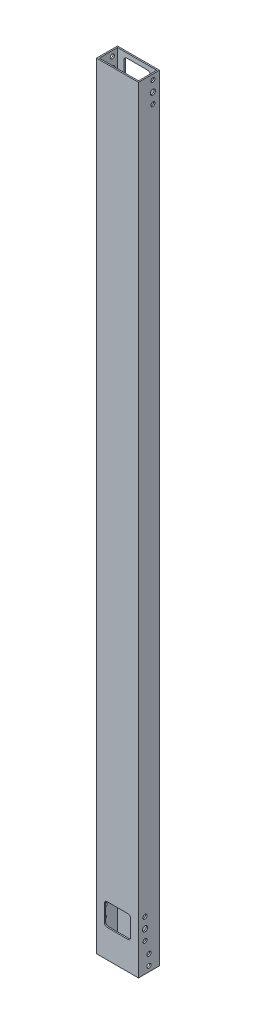
from build123d import *

# Parameters (mm, degrees)
SKETCH1_W               = 50.8
SKETCH1_H               = 939.8
BOSS_EXTRUDE1_DEPTH     = 12.7
SHELL1_T                = -1.5875
CUT_EXTRUDE1_DEPTH      = 471.757326018
CUT_EXTRUDE1_DEPTH_BACK = 471.757326018
SKETCH3_R               = 2.4892
CUT_EXTRUDE2_DEPTH      = 471.757326018
CUT_EXTRUDE2_DEPTH_BACK = 471.757326018
SKETCH4_R               = 3.175
SKETCH4_R_2             = 2.4892
SKETCH5_W               = 31.75
SKETCH5_H               = 26.9875
CUT_EXTRUDE3_DEPTH      = 471.757326018
FILLET1_R               = 3.175
CUT_EXTRUDE4_DEPTH      = 471.757326018
CUT_EXTRUDE4_DEPTH_BACK = 471.757326018
SKETCH6_R               = 3.175
SKETCH6_R_2             = 2.4892
SKETCH7_W               = 31.75
SKETCH7_H               = 26.9875
CUT_EXTRUDE5_DEPTH      = 471.757326018
FILLET2_R               = 3.175


with BuildPart() as part:
    # Sketch1 → Boss-Extrude1 (new, symmetric)
    with BuildSketch(Plane.XY):
        Rectangle(SKETCH1_W, SKETCH1_H)
    extrude(amount=BOSS_EXTRUDE1_DEPTH, both=True)

    # Shell1
    shell1_openings = [part.faces().sort_by_distance(p)[0] for p in [
        (0, -469.9, 0),
        (0, 469.9, 0),
    ]]
    offset(amount=SHELL1_T, openings=shell1_openings, kind=Kind.INTERSECTION)

    # Sketch3 → Cut-Extrude1 (cut, two sides: drawn at the far end of the back side and taken through both)
    with BuildSketch(Plane(origin=(0, 0, 0), x_dir=(0, 0, -1), z_dir=(1, 0, 0)).offset(-CUT_EXTRUDE1_DEPTH_BACK)):
        with Locations((0, -463.55)):
            Circle(SKETCH3_R)
        with Locations((0, -450.85)):
            Circle(SKETCH3_R)
    extrude(amount=CUT_EXTRUDE1_DEPTH + CUT_EXTRUDE1_DEPTH_BACK, mode=Mode.SUBTRACT)

    # Sketch4 → Cut-Extrude2 (cut, two sides: drawn at the far end of the back side and taken through both)
    with BuildSketch(Plane(origin=(0, 0, 0), x_dir=(0, 0, -1), z_dir=(1, 0, 0)).offset(-CUT_EXTRUDE2_DEPTH_BACK)):
        with Locations((-4.7625, -422.275)):
            Circle(SKETCH4_R)
        with Locations((-4.7625, -409.575)):
            Circle(SKETCH4_R_2)
        with Locations((-4.7625, -434.975)):
            Circle(SKETCH4_R_2)
    extrude(amount=CUT_EXTRUDE2_DEPTH + CUT_EXTRUDE2_DEPTH_BACK, mode=Mode.SUBTRACT)

    # Sketch5 → Cut-Extrude3 (cut, through all)
    with BuildSketch(Plane.XY):
        with Locations((0, -422.275)):
            Rectangle(SKETCH5_W, SKETCH5_H)
    extrude(amount=CUT_EXTRUDE3_DEPTH, mode=Mode.SUBTRACT)

    # Fillet1
    fillet1_edges = [part.edges().sort_by_distance(p)[0] for p in [
        (-15.875, -435.76875, 11.90625),
        (15.875, -435.76875, 11.90625),
        (-15.875, -408.78125, 11.90625),
        (15.875, -408.78125, 11.90625),
    ]]
    fillet(fillet1_edges, radius=FILLET1_R)

    # Sketch6 → Cut-Extrude4 (cut, two sides: drawn at the far end of the back side and taken through both)
    with BuildSketch(Plane(origin=(0, 0, 0), x_dir=(0, 0, -1), z_dir=(1, 0, 0)).offset(-CUT_EXTRUDE4_DEPTH_BACK)):
        with Locations((4.7625, 450.85)):
            Circle(SKETCH6_R)
        with Locations((4.7625, 463.55)):
            Circle(SKETCH6_R_2)
        with Locations((4.7625, 438.15)):
            Circle(SKETCH6_R_2)
    extrude(amount=CUT_EXTRUDE4_DEPTH + CUT_EXTRUDE4_DEPTH_BACK, mode=Mode.SUBTRACT)

    # Sketch7 → Cut-Extrude5 (cut, through all)
    with BuildSketch(Plane.XY):
        with Locations((0, 450.85)):
            Rectangle(SKETCH7_W, SKETCH7_H)
    extrude(amount=-CUT_EXTRUDE5_DEPTH, mode=Mode.SUBTRACT)

    # Fillet2
    fillet2_edges = [part.edges().sort_by_distance(p)[0] for p in [
        (15.875, 437.35625, -11.90625),
        (-15.875, 437.35625, -11.90625),
        (-15.875, 464.34375, -11.90625),
        (15.875, 464.34375, -11.90625),
    ]]
    fillet(fillet2_edges, radius=FILLET2_R)


solid = part.part
